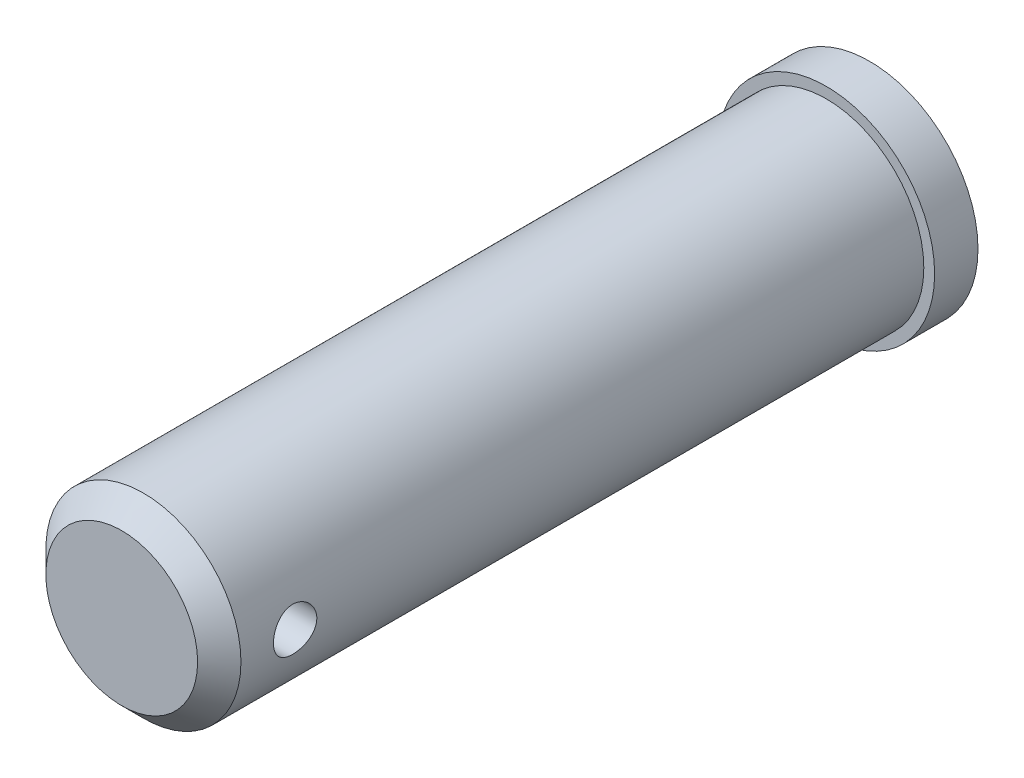
from build123d import *

# Parameters (mm, degrees)
SKETCH1_R           = 10
BOSS_EXTRUDE1_DEPTH = 4
SKETCH2_R           = 9
BOSS_EXTRUDE2_DEPTH = 65
CHAMFER4_SIZE       = 2
SKETCH3_R           = 2
CUT_EXTRUDE1_DEPTH  = 32.5


with BuildPart() as part:
    # Sketch1 → Boss-Extrude1 (new body)
    with BuildSketch(Plane.XY):
        Circle(SKETCH1_R)
    extrude(amount=BOSS_EXTRUDE1_DEPTH)

    # Sketch2 → Boss-Extrude2 (add)
    with BuildSketch(Plane.XY.offset(4)):
        Circle(SKETCH2_R)
    extrude(amount=BOSS_EXTRUDE2_DEPTH)

    # Chamfer4
    chamfer4_edges = [part.edges().sort_by_distance(p)[0] for p in [
        (-9, 0, 69),
    ]]
    chamfer(chamfer4_edges, length=CHAMFER4_SIZE)

    # Sketch3 → Cut-Extrude1 (cut, symmetric)
    with BuildSketch(Plane(origin=(0, 0, 0), x_dir=(0, 0, -1), z_dir=(1, 0, 0))):
        with Locations((-62, 0)):
            Circle(SKETCH3_R)
    extrude(amount=CUT_EXTRUDE1_DEPTH, both=True, mode=Mode.SUBTRACT)


solid = part.part
